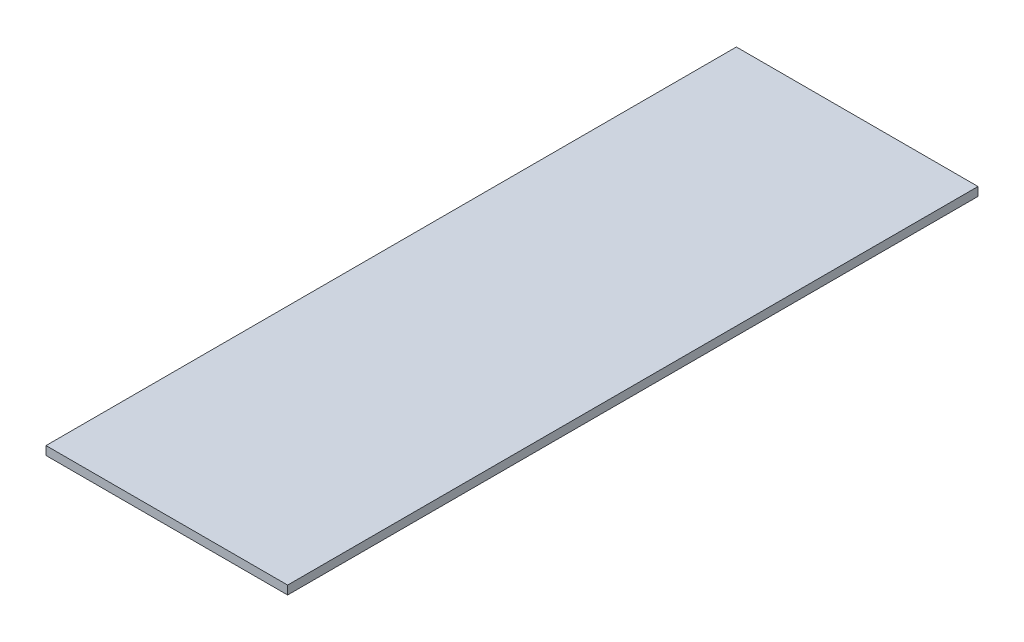
from build123d import *

# Parameters (mm, degrees)
SKETCH1_W           = 140
SKETCH1_H           = 400
BOSS_EXTRUDE1_DEPTH = 5


with BuildPart() as part:
    # Sketch1 → Boss-Extrude1 (new body)
    with BuildSketch(Plane(origin=(0, 0, 0), x_dir=(1, 0, 0), z_dir=(0, 1, 0))):
        Rectangle(SKETCH1_W, SKETCH1_H)
    extrude(amount=BOSS_EXTRUDE1_DEPTH)


solid = part.part
